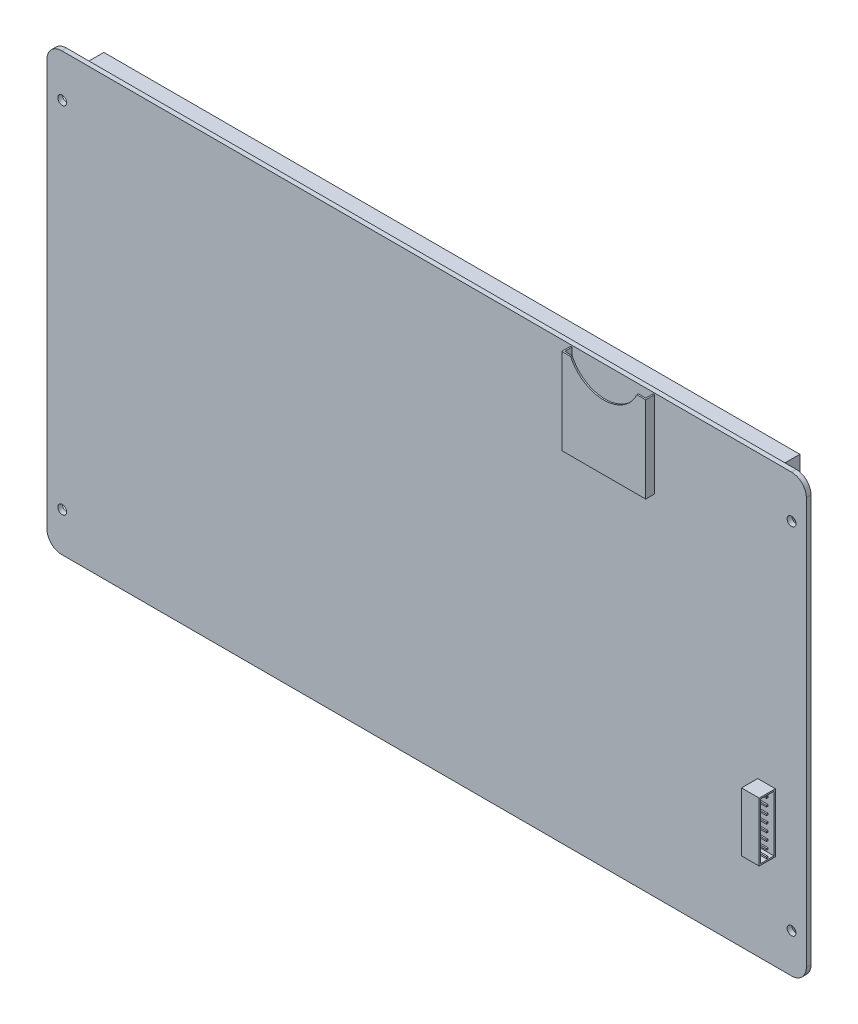
from build123d import *

# Parameters (mm, degrees)
SKETCH_1_W            = 257.9
SKETCH_1_H            = 148.2
EXTRUDE_1_DEPTH       = 1.6
FILLET_1_R            = 5
SKETCH_2_R            = 1.5
CUT_EXTRUDE_857_DEPTH = 1.6
SKETCH_3_W            = 236.4
SKETCH_3_H            = 144.4
EXTRUDE_1142_DEPTH    = 6.4
SKETCH_4_W            = 236.4
SKETCH_4_H            = 144.4
SKETCH_4_W_2          = 225.9
SKETCH_4_H_2          = 127.8
EXTRUDE_1435_DEPTH    = 0.5
SKETCH_5_W            = 222.7
SKETCH_5_H            = 125.3
EXTRUDE_1722_DEPTH    = 0.5
SKETCH_6_W            = 225.9
SKETCH_6_H            = 127.8
SKETCH_6_W_2          = 222.7
SKETCH_6_H_2          = 125.3
EXTRUDE_2013_DEPTH    = 0.4
SKETCH_7_W            = 6
SKETCH_7_H            = 20
EXTRUDE_4_DEPTH       = 5.5
SKETCH_8_W            = 4.5
SKETCH_8_H            = 19
CUT_EXTRUDE_1_DEPTH   = 5
SKETCH_9_W            = 0.5
SKETCH_9_H            = 0.5
EXTRUDE_5_DEPTH       = 5
EXTRUDE_6_DEPTH       = 3
SKETCH_11_W           = 27.5
SKETCH_11_H           = 2.5
CUT_EXTRUDE_2_DEPTH   = 25


with BuildPart() as part:
    # 草图1 → 凸台-拉伸1 (new body)
    with BuildSketch(Plane.XY):
        Rectangle(SKETCH_1_W, SKETCH_1_H)
    extrude(amount=EXTRUDE_1_DEPTH)

    # 圆角1
    fillet_1_edges = [part.edges().sort_by_distance(p)[0] for p in [
        (-128.95, 74.1, 0.8),
        (128.95, 74.1, 0.8),
        (128.95, -74.1, 0.8),
        (-128.95, -74.1, 0.8),
    ]]
    fillet(fillet_1_edges, radius=FILLET_1_R)

    # 草图2 → Cut-Extrude 857 (cut)
    with BuildSketch(Plane.XY):
        with Locations((-123.77, 59.63)):
            Circle(SKETCH_2_R)
        with Locations((123.93, 59.63)):
            Circle(SKETCH_2_R)
        with Locations((123.93, -60.77)):
            Circle(SKETCH_2_R)
        with Locations((-123.77, -60.77)):
            Circle(SKETCH_2_R)
    extrude(amount=CUT_EXTRUDE_857_DEPTH, mode=Mode.SUBTRACT)

    # 草图3 → Extrude 1142 (add)
    with BuildSketch(Plane(origin=(0, 0, 0), x_dir=(-1, 0, 0), z_dir=(0, 0, -1))):
        with Locations((-0.07, 0.07)):
            Rectangle(SKETCH_3_W, SKETCH_3_H)
    extrude(amount=EXTRUDE_1142_DEPTH)

    # 草图4 → Extrude 1435 (add)
    with BuildSketch(Plane(origin=(0, 0, -6.4), x_dir=(-1, 0, 0), z_dir=(0, 0, -1))):
        with Locations((-0.07, 0.07)):
            Rectangle(SKETCH_4_W, SKETCH_4_H)
        with Locations((-1.08, -0.02)):
            Rectangle(SKETCH_4_W_2, SKETCH_4_H_2, mode=Mode.SUBTRACT)
    extrude(amount=EXTRUDE_1435_DEPTH)

    # 草图5 → Extrude 1722 (add)
    with BuildSketch(Plane(origin=(0, 0, -6.4), x_dir=(-1, 0, 0), z_dir=(0, 0, -1))):
        with Locations((-1.08, -0.02)):
            Rectangle(SKETCH_5_W, SKETCH_5_H)
    extrude(amount=EXTRUDE_1722_DEPTH)

    # 草图6 → Extrude 2013 (add)
    with BuildSketch(Plane(origin=(0, 0, -6.4), x_dir=(-1, 0, 0), z_dir=(0, 0, -1))):
        with Locations((-1.08, -0.02)):
            Rectangle(SKETCH_6_W, SKETCH_6_H)
        with Locations((-1.08, -0.02)):
            Rectangle(SKETCH_6_W_2, SKETCH_6_H_2, mode=Mode.SUBTRACT)
    extrude(amount=EXTRUDE_2013_DEPTH)

    # 草图7 → 凸台-拉伸4 (add)
    with BuildSketch(Plane.XY.offset(1.6)):
        with Locations((115.45, -31.77)):
            Rectangle(SKETCH_7_W, SKETCH_7_H)
    extrude(amount=EXTRUDE_4_DEPTH)

    # 草图8 → 切除-拉伸1 (cut)
    with BuildSketch(Plane(origin=(118.45, 0, 0), x_dir=(0, 0, -1), z_dir=(1, 0, 0))):
        with Locations((-4.35, -31.77)):
            Rectangle(SKETCH_8_W, SKETCH_8_H)
    extrude(amount=-CUT_EXTRUDE_1_DEPTH, mode=Mode.SUBTRACT)

    # 草图9 → 凸台-拉伸5 (add)
    with BuildSketch(Plane(origin=(113.45, 0, 0), x_dir=(0, 0, -1), z_dir=(1, 0, 0))):
        with Locations((-4.35, -30.5)):
            Rectangle(SKETCH_9_W, SKETCH_9_H)
        with Locations((-4.35, -27.96)):
            Rectangle(SKETCH_9_W, SKETCH_9_H)
        with Locations((-4.35, -25.42)):
            Rectangle(SKETCH_9_W, SKETCH_9_H)
        with Locations((-4.35, -22.88)):
            Rectangle(SKETCH_9_W, SKETCH_9_H)
        with Locations((-4.35, -40.66)):
            Rectangle(SKETCH_9_W, SKETCH_9_H)
        with Locations((-4.35, -38.12)):
            Rectangle(SKETCH_9_W, SKETCH_9_H)
        with Locations((-4.35, -35.58)):
            Rectangle(SKETCH_9_W, SKETCH_9_H)
        with Locations((-4.35, -33.04)):
            Rectangle(SKETCH_9_W, SKETCH_9_H)
    extrude(amount=EXTRUDE_5_DEPTH)

    # 草图10 → 凸台-拉伸6 (add)
    with BuildSketch(Plane.XY.offset(1.6)):
        with BuildLine():
            Line((51.9, 73.6), (48.9, 73.6))
            Line((48.9, 73.6), (48.9, 44.4))
            Line((48.9, 44.4), (77.4, 44.4))
            Line((77.4, 44.4), (77.4, 73.6))
            Line((77.4, 73.6), (74.4, 73.6))
            ThreePointArc((74.4, 73.6), (63.15, 66.4), (51.9, 73.6))
        make_face()
    extrude(amount=EXTRUDE_6_DEPTH)

    # 草图11 → 切除-拉伸2 (cut)
    with BuildSketch(Plane(origin=(0, 73.6, 0), x_dir=(1, 0, 0), z_dir=(0, 1, 0))):
        with Locations((63.15, -2.85)):
            Rectangle(SKETCH_11_W, SKETCH_11_H)
    extrude(amount=-CUT_EXTRUDE_2_DEPTH, mode=Mode.SUBTRACT)


solid = part.part
